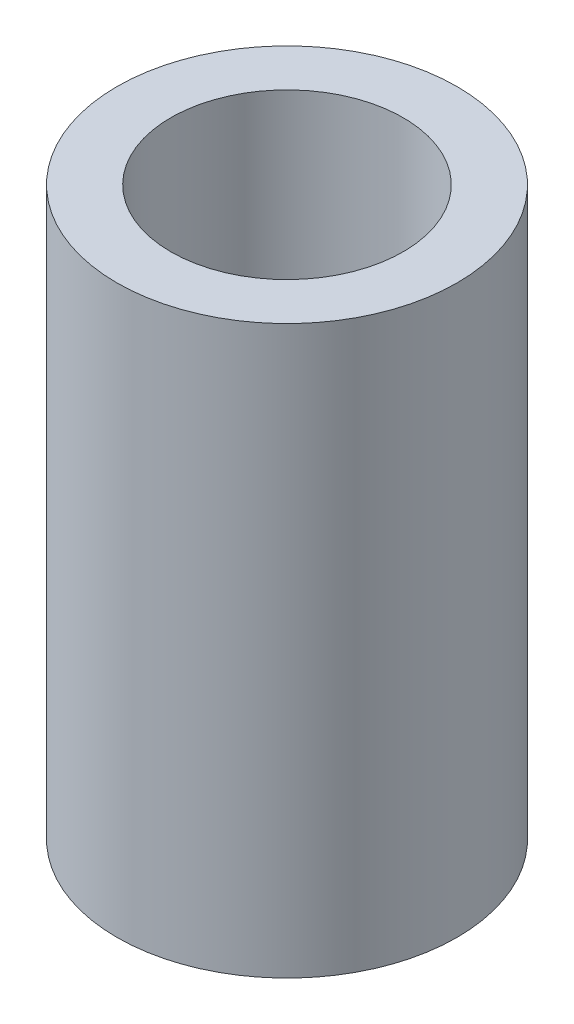
from build123d import *

# Parameters (mm, degrees)
SKETCH1_R           = 6
BOSS_EXTRUDE1_DEPTH = 20
SKETCH2_R           = 4.1
CUT_EXTRUDE1_DEPTH  = 40


with BuildPart() as part:
    # Sketch1 → Boss-Extrude1 (new body)
    with BuildSketch(Plane(origin=(0, 470, 0), x_dir=(1, 0, 0), z_dir=(0, 1, 0))):
        with Locations((300, -157)):
            Circle(SKETCH1_R)
    extrude(amount=BOSS_EXTRUDE1_DEPTH)

    # Sketch2 → Cut-Extrude1 (cut)
    with BuildSketch(Plane(origin=(0, 490, 0), x_dir=(1, 0, 0), z_dir=(0, 1, 0))):
        with Locations((300, -157)):
            Circle(SKETCH2_R)
    extrude(amount=-CUT_EXTRUDE1_DEPTH, mode=Mode.SUBTRACT)


solid = part.part
